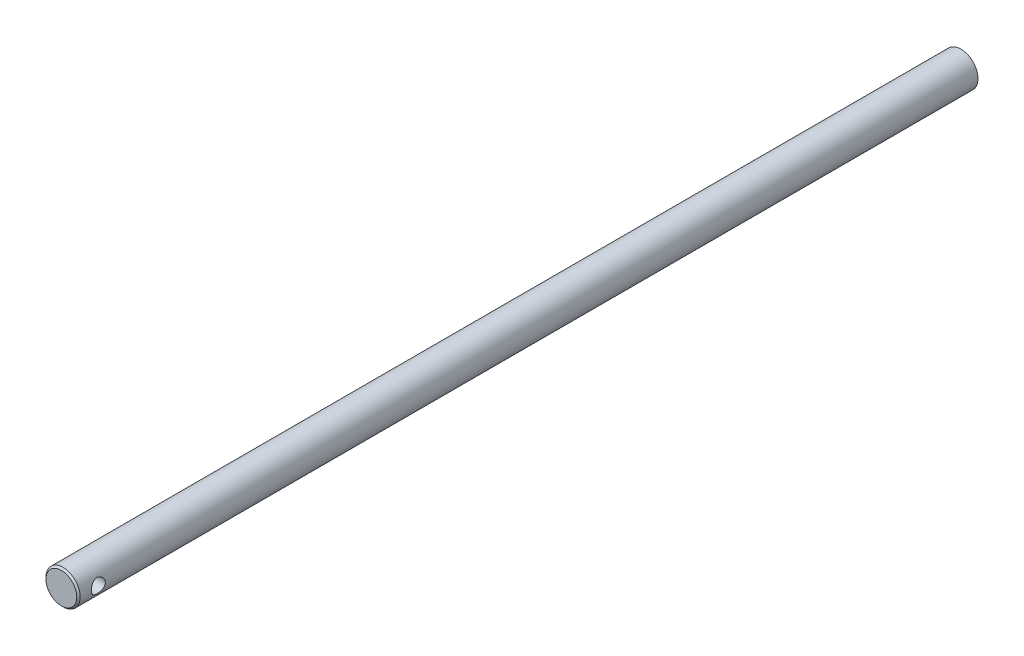
from build123d import *

# Parameters (mm, degrees)
EXTRUDE_1_DEPTH          = 25.6
EXTRUDE_1_DEPTH_BACK     = 500
SKETCH_1_R               = 10
CUT_EXTRUDE_1_DEPTH      = 502.059876661
CUT_EXTRUDE_1_DEPTH_BACK = 502.059876661
SKETCH_2_R               = 4.1
CHAMFER_1_SIZE           = 1


with BuildPart() as part:
    # Эскиз1 → Бобышка-Вытянуть1 (new, two sides: drawn at the far end of the back side and taken through both)
    with BuildSketch(Plane.XY.offset(-EXTRUDE_1_DEPTH_BACK)):
        with Locations((21, 0)):
            Circle(SKETCH_1_R)
    extrude(amount=EXTRUDE_1_DEPTH + EXTRUDE_1_DEPTH_BACK)

    # Эскиз2 → Вырез-Вытянуть1 (cut, two sides: drawn at the far end of the back side and taken through both)
    with BuildSketch(Plane(origin=(0, 0, 0), x_dir=(0, 0, -1), z_dir=(1, 0, 0)).offset(-CUT_EXTRUDE_1_DEPTH_BACK)):
        with Locations((-14, 0)):
            Circle(SKETCH_2_R)
    extrude(amount=CUT_EXTRUDE_1_DEPTH + CUT_EXTRUDE_1_DEPTH_BACK, mode=Mode.SUBTRACT)

    # Фаска1
    chamfer_1_edges = [part.edges().sort_by_distance(p)[0] for p in [
        (11, 0, 25.6),
    ]]
    chamfer(chamfer_1_edges, length=CHAMFER_1_SIZE)


solid = part.part
